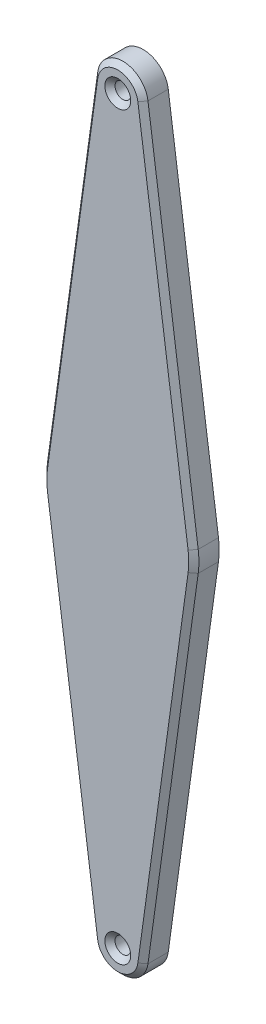
from build123d import *

# Parameters (mm, degrees)
BOSS_EXTRUDE1_DEPTH      = 5
CHAMFER1_SIZE            = 1
CUT_EXTRUDE2_REACH       = 179.034
SKETCH6_R                = 1.55
CHAMFER3_SIZE            = 1
CHAMFER3_OF_MIRROR2_SIZE = 1


with BuildPart() as part:
    # Sketch1 → Boss-Extrude1 (new body)
    with BuildSketch(Plane.XY):
        with BuildLine():
            ThreePointArc((99.858594129, 65.945205479), (100, 68), (99.858594129, 70.054794521))
            Line((99.858594129, 70.054794521), (89.95286471, 141.684931507))
            ThreePointArc((89.95286471, 141.684931507), (85, 146), (80.04713529, 141.684931507))
            Line((80.04713529, 141.684931507), (70.141405871, 70.054794521))
            ThreePointArc((70.141405871, 70.054794521), (70, 68), (70.141405871, 65.945205479))
            Line((70.141405871, 65.945205479), (80.04713529, -5.684931507))
            ThreePointArc((80.04713529, -5.684931507), (85, -10), (89.95286471, -5.684931507))
            Line((89.95286471, -5.684931507), (99.858594129, 65.945205479))
        make_face()
    extrude(amount=BOSS_EXTRUDE1_DEPTH)

    # Chamfer1
    chamfer1_edges = [part.edges().sort_by_distance(p)[0] for p in [
        (75.094270581, 30.130136986, 5),
        (70, 68, 5),
        (75.094270581, 105.869863014, 5),
        (85, 146, 5),
        (94.905729419, 105.869863014, 5),
        (100, 68, 5),
        (94.905729419, 30.130136986, 5),
        (85, -10, 5),
    ]]
    chamfer(chamfer1_edges, length=CHAMFER1_SIZE)

    # Sketch6 → Cut-Extrude2 (cut, up to next)
    with BuildSketch(Plane.XY.offset(5), mode=Mode.PRIVATE) as cut_extrude2_sk1:
        with Locations((85, 141)):
            Circle(SKETCH6_R)
    cut_extrude2_tool1 = extrude(cut_extrude2_sk1.sketch, amount=-CUT_EXTRUDE2_REACH, mode=Mode.PRIVATE) & part.part
    cut_extrude2 = cut_extrude2_tool1.solids().sort_by_distance((85, 141, 5))[0]
    add(cut_extrude2, mode=Mode.SUBTRACT)

    # Chamfer3
    chamfer3_edges = [part.edges().sort_by_distance(p)[0] for p in [
        (83.45, 141, 5),
    ]]
    chamfer(chamfer3_edges, length=CHAMFER3_SIZE)

    # Mirror2: Cut-Extrude2 across plane
    add(cut_extrude2.mirror(Plane(origin=(0, 68, 0), x_dir=(0, -3.1724622928663687e-12, 1.0), z_dir=(0, -1.0, -3.1724622928663687e-12))), mode=Mode.SUBTRACT)

    # Chamfer3 of Mirror2
    chamfer3_of_mirror2_edges = [part.edges().sort_by_distance(p)[0] for p in [
        (83.45, -5, 5),
    ]]
    chamfer(chamfer3_of_mirror2_edges, length=CHAMFER3_OF_MIRROR2_SIZE)


solid = part.part
